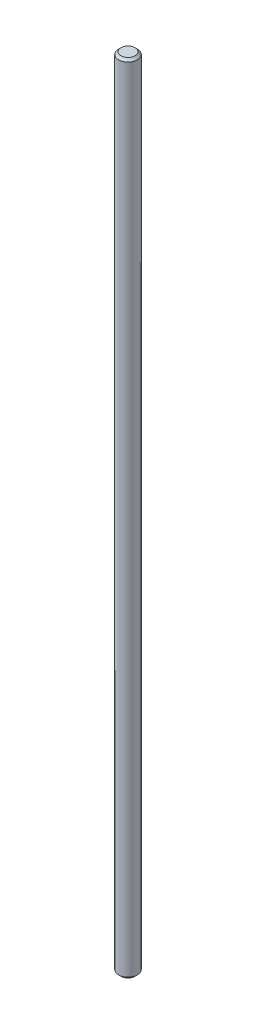
from build123d import *

# Parameters (mm, degrees)
SKETCH1_R           = 4
BOSS_EXTRUDE1_DEPTH = 340
CHAMFER1_SIZE       = 1


with BuildPart() as part:
    # Sketch1 → Boss-Extrude1 (new body)
    with BuildSketch(Plane(origin=(0, 340, 0), x_dir=(1, 0, 0), z_dir=(0, 1, 0))):
        Circle(SKETCH1_R)
    extrude(amount=-BOSS_EXTRUDE1_DEPTH)

    # Chamfer1
    chamfer1_edges = [part.edges().sort_by_distance(p)[0] for p in [
        (-4, 0, 0),
        (-4, 340, 0),
    ]]
    chamfer(chamfer1_edges, length=CHAMFER1_SIZE)


solid = part.part
